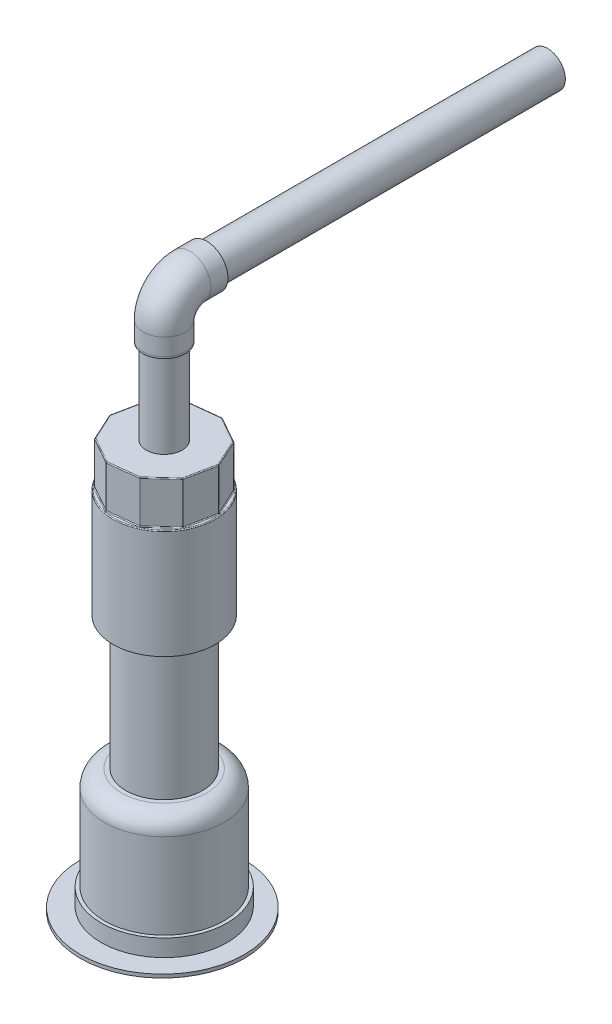
from build123d import *

# Parameters (mm, degrees)
SKETCH3_R            = 48.1
BOSS_EXTRUDE3_DEPTH  = 200
CUT_EXTRUDE2_START   = -198
SKETCH4_R            = 48.1
SKETCH4_R_2          = 35
CUT_EXTRUDE2_DEPTH   = 198
CUT_EXTRUDE3_START   = -128
SKETCH5_R            = 35
SKETCH5_R_2          = 22.5
CUT_EXTRUDE3_DEPTH   = 128
FILLET1_R            = 10
SKETCH6_R            = 20.5
CUT_EXTRUDE4_DEPTH   = 200
FILLET2_R            = 2
SKETCH7_R            = 34.5
CUT_EXTRUDE9_DEPTH   = 56
FILLET3_R            = 4
BOSS_EXTRUDE15_START = -3
BOSS_EXTRUDE15_DEPTH = 3
SKETCH9_R            = 16.65771223
SKETCH9_R_2          = 13.585913138
BOSS_EXTRUDE16_DEPTH = 3
SKETCH10_R           = 30
BOSS_EXTRUDE17_DEPTH = 89
SKETCH11_R           = 10.5
CUT_EXTRUDE10_DEPTH  = 89
CUT_EXTRUDE12_START  = -25
SKETCH12_R           = 30
SKETCH12_R_2         = 23
CUT_EXTRUDE12_DEPTH  = 25
BOSS_EXTRUDE18_START = -25
SKETCH13_R           = 23
BOSS_EXTRUDE18_DEPTH = 25
FILLET4_R            = 0.5
SKETCH14_R           = 10.5
BOSS_EXTRUDE19_DEPTH = 50
SKETCH15_R           = 9.5
CUT_EXTRUDE13_DEPTH  = 178
SKETCH89_R           = 12.416583526
SKETCH89_R_2         = 10.5
BOSS_EXTRUDE20_DEPTH = 1
SWEEP2_PROFILE_R     = 12.415
SHELL3_START         = 292
SHELL3_OUTLINE_R     = 10.415
SHELL3_DEPTH         = 10.585
SHELL3_START_2       = -25
SHELL3_2_OUTLINE_R   = 10.415
SHELL3_2_DEPTH       = 34.959190965
SHELL3_3_OUTLINE_R   = 10.415
SHELL3_3_ANGLE       = 90
SHELL3_4_OUTLINE_R   = 12.415
SHELL3_4_OUTLINE_R_2 = 10.415
SHELL3_4_ANGLE       = 90
SKETCH138_R          = 10.415
BOSS_EXTRUDE21_DEPTH = 200
SHELL4_T             = -1
SKETCH139_R          = 37
SKETCH139_R_2        = 35
BOSS_EXTRUDE22_DEPTH = 10
BOSS_EXTRUDE23_START = -12
SKETCH140_R          = 34.5
SKETCH140_R_2        = 33.5
BOSS_EXTRUDE23_DEPTH = 12


with BuildPart() as part:
    # Sketch3 → Boss-Extrude3 (new body)
    with BuildSketch(Plane(origin=(0, 0, 0), x_dir=(1, 0, 0), z_dir=(0, 1, 0))):
        with Locations(Location((0, -1.066725124, 0), (0, 0, 270))):
            Circle(SKETCH3_R)
    extrude(amount=BOSS_EXTRUDE3_DEPTH)

    # Sketch4 → Cut-Extrude2 (cut)
    with BuildSketch(Plane(origin=(0, 200, 0), x_dir=(1, 0, 0), z_dir=(0, 1, 0)).offset(CUT_EXTRUDE2_START)):
        with Locations(Location((0, -1.066725124, 0), (0, 0, 270))):
            Circle(SKETCH4_R)
        with Locations(Location((0, 0, 0), (0, 0, 270))):
            Circle(SKETCH4_R_2, mode=Mode.SUBTRACT)
    extrude(amount=CUT_EXTRUDE2_DEPTH, mode=Mode.SUBTRACT)

    # Sketch5 → Cut-Extrude3 (cut)
    with BuildSketch(Plane(origin=(0, 200, 0), x_dir=(1, 0, 0), z_dir=(0, 1, 0)).offset(CUT_EXTRUDE3_START)):
        with Locations(Location((0, 0, 0), (0, 0, 270))):
            Circle(SKETCH5_R)
        with Locations(Location((0, 0, 0), (0, 0, 270))):
            Circle(SKETCH5_R_2, mode=Mode.SUBTRACT)
    extrude(amount=CUT_EXTRUDE3_DEPTH, mode=Mode.SUBTRACT)

    # Fillet1
    fillet1_edges = [part.edges().sort_by_distance(p)[0] for p in [
        (0, 72, -35),
    ]]
    fillet(fillet1_edges, radius=FILLET1_R)

    # Sketch6 → Cut-Extrude4 (cut)
    with BuildSketch(Plane(origin=(0, 200, 0), x_dir=(1, 0, 0), z_dir=(0, 1, 0))):
        with Locations(Location((0, 0, 0), (0, 0, 270))):
            Circle(SKETCH6_R)
    extrude(amount=-CUT_EXTRUDE4_DEPTH, mode=Mode.SUBTRACT)

    # Fillet2
    fillet2_edges = [part.edges().sort_by_distance(p)[0] for p in [
        (0, 2, -35),
    ]]
    fillet(fillet2_edges, radius=FILLET2_R)

    # Sketch7 → Cut-Extrude9 (cut)
    with BuildSketch(Plane(origin=(0, 0, 0), x_dir=(-1, 0, 0), z_dir=(0, -1, 0))):
        with Locations(Location((0, 0, 0), (0, 0, 90))):
            Circle(SKETCH7_R)
    extrude(amount=-CUT_EXTRUDE9_DEPTH, mode=Mode.SUBTRACT)

    # Fillet3
    fillet3_edges = [part.edges().sort_by_distance(p)[0] for p in [
        (0, 56, 34.5),
    ]]
    fillet(fillet3_edges, radius=FILLET3_R)

    # Sketch8 → Boss-Extrude15 (add)
    with BuildSketch(Plane.XZ.offset(-56).offset(BOSS_EXTRUDE15_START)):
        with BuildLine():
            Line((-10.229411681, 12.757044011), (-12.824415894, 15.993259736))
            ThreePointArc((-12.824415894, 15.993259736), (-13.590203309, 15.347845908), (-14.323555674, 14.665802155))
            Line((-14.323555674, 14.665802155), (-11.789729704, 11.505881484))
            ThreePointArc((-11.789729704, 11.505881484), (-11.368038552, 10.746495381), (-11.221966987, 9.890251386))
            ThreePointArc((-11.221966987, 9.890251386), (-10.090784005, 7.15933409), (-7.359866709, 6.028151109))
            ThreePointArc((-7.359866709, 6.028151109), (-6.492486801, 6.006383058), (-5.62729071, 5.94113371))
            ThreePointArc((-5.62729071, 5.94113371), (-6.742287762, 4.637351208), (-7.560958981, 3.129755548))
            ThreePointArc((-7.560958981, 3.129755548), (-9.294403805, 1.892908691), (-10.880971748, 0.472548431))
            ThreePointArc((-10.880971748, 0.472548431), (-12.197675482, -0.072848113), (-13.514379215, 0.472548431))
            ThreePointArc((-13.514379215, 0.472548431), (-14.771982948, 1.363600645), (-16.253878695, 1.787305961))
            Line((-16.253878695, 1.787305961), (-20.377173856, 2.24071097))
            ThreePointArc((-20.377173856, 2.24071097), (-20.462290836, 1.242841001), (-20.498571503, 0.242004807))
            Line((-20.498571503, 0.242004807), (-16.472484643, -0.200711001))
            ThreePointArc((-16.472484643, -0.200711001), (-15.637336907, -0.439497391), (-14.928592777, -0.941665132))
            ThreePointArc((-14.928592777, -0.941665132), (-12.197675482, -2.072848113), (-9.466758186, -0.941665132))
            ThreePointArc((-9.466758186, -0.941665132), (-8.838035634, -0.343727253), (-8.180111355, 0.221920514))
            ThreePointArc((-8.180111355, 0.221920514), (-8.046619884, -1.488414911), (-7.559476739, -3.133333996))
            ThreePointArc((-7.559476739, -3.133333996), (-7.910624529, -5.233647386), (-8.028151109, -7.359866709))
            ThreePointArc((-8.028151109, -7.359866709), (-8.573547653, -8.676570443), (-9.890251386, -9.221966987))
            ThreePointArc((-9.890251386, -9.221966987), (-11.409580577, -9.481158051), (-12.757044011, -10.229411681))
            Line((-12.757044011, -10.229411681), (-15.993259736, -12.824415894))
            ThreePointArc((-15.993259736, -12.824415894), (-15.347845908, -13.590203309), (-14.665802155, -14.323555674))
            Line((-14.665802155, -14.323555674), (-11.505881484, -11.789729704))
            ThreePointArc((-11.505881484, -11.789729704), (-10.746495381, -11.368038552), (-9.890251386, -11.221966987))
            ThreePointArc((-9.890251386, -11.221966987), (-7.15933409, -10.090784005), (-6.028151109, -7.359866709))
            ThreePointArc((-6.028151109, -7.359866709), (-6.006383058, -6.492486801), (-5.94113371, -5.62729071))
            ThreePointArc((-5.94113371, -5.62729071), (-4.637351208, -6.742287762), (-3.129755548, -7.560958981))
            ThreePointArc((-3.129755548, -7.560958981), (-1.892908691, -9.294403805), (-0.472548431, -10.880971748))
            ThreePointArc((-0.472548431, -10.880971748), (0.072848113, -12.197675482), (-0.472548431, -13.514379215))
            ThreePointArc((-0.472548431, -13.514379215), (-1.363600645, -14.771982948), (-1.787305961, -16.253878695))
            Line((-1.787305961, -16.253878695), (-2.24071097, -20.377173856))
            ThreePointArc((-2.24071097, -20.377173856), (-1.242841001, -20.462290836), (-0.242004807, -20.498571503))
            Line((-0.242004807, -20.498571503), (0.200711001, -16.472484643))
            ThreePointArc((0.200711001, -16.472484643), (0.439497391, -15.637336907), (0.941665132, -14.928592777))
            ThreePointArc((0.941665132, -14.928592777), (2.072848113, -12.197675482), (0.941665132, -9.466758186))
            ThreePointArc((0.941665132, -9.466758186), (0.343727253, -8.838035634), (-0.221920514, -8.180111355))
            ThreePointArc((-0.221920514, -8.180111355), (1.488414911, -8.046619884), (3.133333996, -7.559476739))
            ThreePointArc((3.133333996, -7.559476739), (5.233647386, -7.910624529), (7.359866709, -8.028151109))
            ThreePointArc((7.359866709, -8.028151109), (8.676570443, -8.573547653), (9.221966987, -9.890251386))
            ThreePointArc((9.221966987, -9.890251386), (9.481158051, -11.409580577), (10.229411681, -12.757044011))
            Line((10.229411681, -12.757044011), (12.824415894, -15.993259736))
            ThreePointArc((12.824415894, -15.993259736), (13.590203309, -15.347845908), (14.323555674, -14.665802155))
            Line((14.323555674, -14.665802155), (11.789729704, -11.505881484))
            ThreePointArc((11.789729704, -11.505881484), (11.368038552, -10.746495381), (11.221966987, -9.890251386))
            ThreePointArc((11.221966987, -9.890251386), (10.090784005, -7.15933409), (7.359866709, -6.028151109))
            ThreePointArc((7.359866709, -6.028151109), (6.492486801, -6.006383058), (5.62729071, -5.94113371))
            ThreePointArc((5.62729071, -5.94113371), (6.742287762, -4.637351208), (7.560958981, -3.129755548))
            ThreePointArc((7.560958981, -3.129755548), (9.294403805, -1.892908691), (10.880971748, -0.472548431))
            ThreePointArc((10.880971748, -0.472548431), (12.197675482, 0.072848113), (13.514379215, -0.472548431))
            ThreePointArc((13.514379215, -0.472548431), (14.771982948, -1.363600645), (16.253878695, -1.787305961))
            Line((16.253878695, -1.787305961), (20.377173856, -2.24071097))
            ThreePointArc((20.377173856, -2.24071097), (20.462290836, -1.242841001), (20.498571503, -0.242004807))
            Line((20.498571503, -0.242004807), (16.472484643, 0.200711001))
            ThreePointArc((16.472484643, 0.200711001), (15.637336907, 0.439497391), (14.928592777, 0.941665132))
            ThreePointArc((14.928592777, 0.941665132), (12.197675482, 2.072848113), (9.466758186, 0.941665132))
            ThreePointArc((9.466758186, 0.941665132), (8.838035634, 0.343727253), (8.180111355, -0.221920514))
            ThreePointArc((8.180111355, -0.221920514), (8.046619884, 1.488414911), (7.559476739, 3.133333996))
            ThreePointArc((7.559476739, 3.133333996), (7.910624529, 5.233647386), (8.028151109, 7.359866709))
            ThreePointArc((8.028151109, 7.359866709), (8.573547653, 8.676570443), (9.890251386, 9.221966987))
            ThreePointArc((9.890251386, 9.221966987), (11.409580577, 9.481158051), (12.757044011, 10.229411681))
            Line((12.757044011, 10.229411681), (15.993259736, 12.824415894))
            ThreePointArc((15.993259736, 12.824415894), (15.347845908, 13.590203309), (14.665802155, 14.323555674))
            Line((14.665802155, 14.323555674), (11.505881484, 11.789729704))
            ThreePointArc((11.505881484, 11.789729704), (10.746495381, 11.368038552), (9.890251386, 11.221966987))
            ThreePointArc((9.890251386, 11.221966987), (7.15933409, 10.090784005), (6.028151109, 7.359866709))
            ThreePointArc((6.028151109, 7.359866709), (6.006383058, 6.492486801), (5.94113371, 5.62729071))
            ThreePointArc((5.94113371, 5.62729071), (4.637351208, 6.742287762), (3.129755548, 7.560958981))
            ThreePointArc((3.129755548, 7.560958981), (1.892908691, 9.294403805), (0.472548431, 10.880971748))
            ThreePointArc((0.472548431, 10.880971748), (-0.072848113, 12.197675482), (0.472548431, 13.514379215))
            ThreePointArc((0.472548431, 13.514379215), (1.363600645, 14.771982948), (1.787305961, 16.253878695))
            Line((1.787305961, 16.253878695), (2.24071097, 20.377173856))
            ThreePointArc((2.24071097, 20.377173856), (1.242841001, 20.462290836), (0.242004807, 20.498571503))
            Line((0.242004807, 20.498571503), (-0.200711001, 16.472484643))
            ThreePointArc((-0.200711001, 16.472484643), (-0.439497391, 15.637336907), (-0.941665132, 14.928592777))
            ThreePointArc((-0.941665132, 14.928592777), (-2.072848113, 12.197675482), (-0.941665132, 9.466758186))
            ThreePointArc((-0.941665132, 9.466758186), (-0.343727253, 8.838035634), (0.221920514, 8.180111355))
            ThreePointArc((0.221920514, 8.180111355), (-1.488414911, 8.046619884), (-3.133333996, 7.559476739))
            ThreePointArc((-3.133333996, 7.559476739), (-5.233647386, 7.910624529), (-7.359866709, 8.028151109))
            ThreePointArc((-7.359866709, 8.028151109), (-8.676570443, 8.573547653), (-9.221966987, 9.890251386))
            ThreePointArc((-9.221966987, 9.890251386), (-9.481158051, 11.409580577), (-10.229411681, 12.757044011))
        make_face()
    extrude(amount=BOSS_EXTRUDE15_DEPTH)

    # Sketch9 → Boss-Extrude16 (add)
    with BuildSketch(Plane.XZ.offset(-56)):
        Circle(SKETCH9_R)
        Circle(SKETCH9_R_2, mode=Mode.SUBTRACT)
    extrude(amount=-BOSS_EXTRUDE16_DEPTH)

    # Sketch10 → Boss-Extrude17 (add)
    with BuildSketch(Plane(origin=(0, 150, 0), x_dir=(1, 0, 0), z_dir=(0, 1, 0))):
        with Locations(Location((0, 0, 0), (0, 0, 270))):
            Circle(SKETCH10_R)
    extrude(amount=BOSS_EXTRUDE17_DEPTH)

    # Sketch11 → Cut-Extrude10 (cut)
    with BuildSketch(Plane(origin=(0, 239, 0), x_dir=(1, 0, 0), z_dir=(0, 1, 0))):
        with Locations(Location((0, 0, 0), (0, 0, 270))):
            Circle(SKETCH11_R)
    extrude(amount=-CUT_EXTRUDE10_DEPTH, mode=Mode.SUBTRACT)

    # Sketch12 → Cut-Extrude12 (cut)
    with BuildSketch(Plane(origin=(0, 239, 0), x_dir=(1, 0, 0), z_dir=(0, 1, 0)).offset(CUT_EXTRUDE12_START)):
        with Locations(Location((0, 0, 0), (0, 0, 270))):
            Circle(SKETCH12_R)
        with Locations(Location((0, 0, 0), (0, 0, 270))):
            Circle(SKETCH12_R_2, mode=Mode.SUBTRACT)
    extrude(amount=CUT_EXTRUDE12_DEPTH, mode=Mode.SUBTRACT)

    # Sketch13 → Boss-Extrude18 (add)
    with BuildSketch(Plane(origin=(0, 239, 0), x_dir=(1, 0, 0), z_dir=(0, 1, 0)).offset(BOSS_EXTRUDE18_START)):
        Polygon((28.724826344, 3.312670875), (21.291733587, 19.564036334), (5.725922279, 28.342604871), (-12.026996723, 26.295261677), (-25.186011759, 14.204022265), (-28.724826344, -3.312670875), (-21.291733587, -19.564036334), (-5.725922279, -28.342604871), (12.026996723, -26.295261677), (25.186011759, -14.204022265), align=None)
        Circle(SKETCH13_R, mode=Mode.SUBTRACT)
    extrude(amount=BOSS_EXTRUDE18_DEPTH)

    # Fillet4
    fillet4_edges = [part.edges().sort_by_distance(p)[0] for p in [
        (0, 214, -30),
        (5.725922279, 226.5, -28.342604871),
        (-12.026996723, 226.5, -26.295261677),
        (-25.186011759, 226.5, -14.204022265),
        (-28.724826344, 226.5, 3.312670875),
        (-21.291733587, 226.5, 19.564036334),
        (-5.725922279, 226.5, 28.342604871),
        (12.026996723, 226.5, 26.295261677),
        (25.186011759, 226.5, 14.204022265),
        (28.724826344, 226.5, -3.312670875),
        (21.291733587, 226.5, -19.564036334),
        (25.008279965, 239, -11.438353604),
        (13.508827933, 239, -23.953320602),
        (-3.150537222, 239, -27.318933274),
        (-18.606504241, 239, -20.249641971),
        (-26.955419051, 239, -5.445675695),
        (-25.008279965, 239, 11.438353604),
        (-13.508827933, 239, 23.953320602),
        (3.150537222, 239, 27.318933274),
        (18.606504241, 239, 20.249641971),
        (26.955419051, 239, 5.445675695),
        (25.008279965, 214, -11.438353604),
        (26.955419051, 214, 5.445675695),
        (18.606504241, 214, 20.249641971),
        (3.150537222, 214, 27.318933274),
        (-13.508827933, 214, 23.953320602),
        (-25.008279965, 214, 11.438353604),
        (-26.955419051, 214, -5.445675695),
        (-18.606504241, 214, -20.249641971),
        (-3.150537222, 214, -27.318933274),
        (13.508827933, 214, -23.953320602),
    ]]
    fillet(fillet4_edges, radius=FILLET4_R)

    # Sketch139 → Boss-Extrude22 (add)
    with BuildSketch(Plane(origin=(0, 2, 0), x_dir=(1, 0, 0), z_dir=(0, 1, 0))):
        with Locations(Location((0, 0, 0), (0, 0, 270))):
            Circle(SKETCH139_R)
        with Locations(Location((0, 0, 0), (0, 0, 270))):
            Circle(SKETCH139_R_2, mode=Mode.SUBTRACT)
    extrude(amount=BOSS_EXTRUDE22_DEPTH)

    # Sketch140 → Boss-Extrude23 (add)
    with BuildSketch(Plane(origin=(0, 12, 0), x_dir=(1, 0, 0), z_dir=(0, 1, 0)).offset(BOSS_EXTRUDE23_START)):
        with Locations(Location((0, 0, 0), (0, 0, 90))):
            Circle(SKETCH140_R)
        with Locations(Location((0, 0, 0), (0, 0, 270))):
            Circle(SKETCH140_R_2, mode=Mode.SUBTRACT)
    extrude(amount=BOSS_EXTRUDE23_DEPTH)


with BuildPart() as body_2:
    # Sketch14 → Boss-Extrude19 (new body)
    with BuildSketch(Plane(origin=(0, 239, 0), x_dir=(1, 0, 0), z_dir=(0, 1, 0))):
        with Locations(Location((0, 0, 0), (0, 0, 270))):
            Circle(SKETCH14_R)
    extrude(amount=BOSS_EXTRUDE19_DEPTH)

    # Sketch15 → Cut-Extrude13 (cut)
    with BuildSketch(Plane(origin=(0, 289, 0), x_dir=(1, 0, 0), z_dir=(0, 1, 0))):
        with Locations(Location((0, 0, 0), (0, 0, 270))):
            Circle(SKETCH15_R)
    extrude(amount=-CUT_EXTRUDE13_DEPTH, mode=Mode.SUBTRACT)


with BuildPart() as body_3:
    # Sketch89 → Boss-Extrude20 (new body)
    with BuildSketch(Plane(origin=(0, 289, 0), x_dir=(1, 0, 0), z_dir=(0, 1, 0))):
        with Locations(Location((0, 0, 0), (0, 0, 270))):
            Circle(SKETCH89_R)
        with Locations(Location((0, 0, 0), (0, 0, 270))):
            Circle(SKETCH89_R_2, mode=Mode.SUBTRACT)
    extrude(amount=BOSS_EXTRUDE20_DEPTH)

    # Sweep2: sweep along a path in Sketch91
    with BuildLine(Plane(origin=(0, 0, 0), x_dir=(0, 0, -1), z_dir=(1, 0, 0))) as sweep2_path:
        Line((0, 290), (0, 300))
        ThreePointArc((0, 300), (4.393398282, 310.606601718), (15, 315))
        Line((15, 315), (25, 315))
    # Sweep2 profile (on start of the path) → Sweep2 (sweep)
    with BuildSketch(Plane.ZX.offset(290)):
        Circle(SWEEP2_PROFILE_R)
    sweep(path=sweep2_path.line)

    # Shell3: read off the stored shape, not the designer's step
    # Shell3 outline → Shell3 (cut)
    with BuildSketch(Plane(origin=(0, 0, 0), x_dir=(1, 0, 0), z_dir=(0, 1, 0)).offset(SHELL3_START)):
        Circle(SHELL3_OUTLINE_R)
    extrude(amount=SHELL3_DEPTH, mode=Mode.SUBTRACT)

    # Shell3 2 outline → Shell3 2 (cut)
    with BuildSketch(Plane.XY.offset(SHELL3_START_2)):
        with Locations((0, 315)):
            Circle(SHELL3_2_OUTLINE_R)
    extrude(amount=SHELL3_2_DEPTH, mode=Mode.SUBTRACT)

    # Shell3 3 outline → Shell3 3 (revolve, cut)
    with BuildSketch(Plane(origin=(0, 300, -15), x_dir=(0, 1, 0), z_dir=(0, 0, -1))):
        with Locations((15, 0)):
            Circle(SHELL3_3_OUTLINE_R)
    revolve(axis=Axis((0, 300, -15), (1, 0, 0)), revolution_arc=SHELL3_3_ANGLE, mode=Mode.SUBTRACT)

    # Shell3 4 outline → Shell3 4 (revolve)
    with BuildSketch(Plane(origin=(0, 300, -15), x_dir=(0, 1, 0), z_dir=(0, 0, -1))):
        with Locations((15, 0)):
            Circle(SHELL3_4_OUTLINE_R)
        with Locations((15, 0)):
            Circle(SHELL3_4_OUTLINE_R_2, mode=Mode.SUBTRACT)
    revolve(axis=Axis((0, 300, -15), (1, 0, 0)), revolution_arc=SHELL3_4_ANGLE)


with BuildPart() as body_4:
    # Sketch138 → Boss-Extrude21 (new body)
    with BuildSketch(Plane(origin=(0, 0, -25), x_dir=(-1, 0, 0), z_dir=(0, 0, -1))):
        with Locations((0, 315)):
            Circle(SKETCH138_R)
    extrude(amount=BOSS_EXTRUDE21_DEPTH)

    # Shell4
    shell4_openings = [body_4.faces().sort_by_distance(p)[0] for p in [
        (0, 315, -225),
    ]]
    offset(amount=SHELL4_T, openings=shell4_openings, kind=Kind.INTERSECTION)


solid = Compound([part.part, body_2.part, body_3.part, body_4.part])
